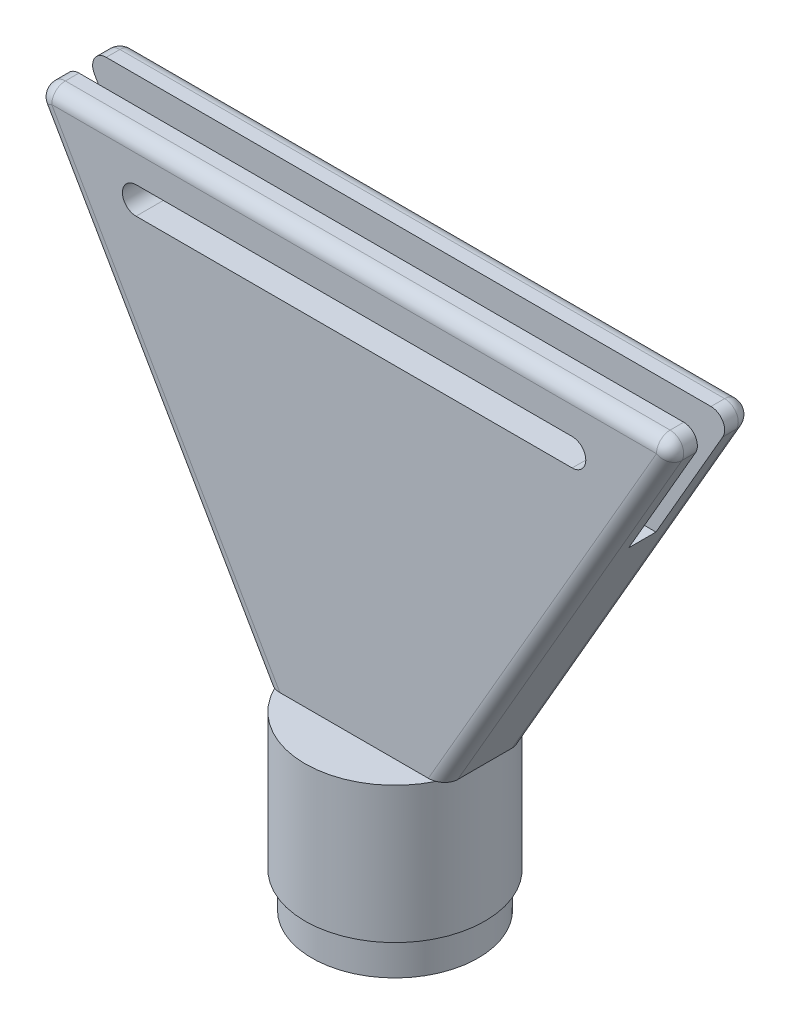
from build123d import *

# Parameters (mm, degrees)
SKETCH1_R           = 15.494
BOSS_EXTRUDE1_DEPTH = 6.604
SKETCH2_R           = 16.764
BOSS_EXTRUDE2_DEPTH = 25.4
BOSS_EXTRUDE3_DEPTH = 7.62
FILLET1_R           = 2.54
SKETCH5_W           = 117.797362922
SKETCH5_H           = 5.08
CUT_EXTRUDE1_DEPTH  = 25.4
CUT_EXTRUDE2_DEPTH  = 25.4


with BuildPart() as part:
    # Sketch1 → Boss-Extrude1 (new body)
    with BuildSketch(Plane(origin=(0, 0, 0), x_dir=(1, 0, 0), z_dir=(0, 1, 0))):
        with Locations(Location((0, 0, 0), (0, 0, 90))):
            Circle(SKETCH1_R)
    extrude(amount=BOSS_EXTRUDE1_DEPTH)

    # Sketch2 → Boss-Extrude2 (add)
    with BuildSketch(Plane(origin=(0, 6.604, 0), x_dir=(1, 0, 0), z_dir=(0, 1, 0))):
        with Locations(Location((0, 0, 0), (0, 0, 270))):
            Circle(SKETCH2_R)
    extrude(amount=BOSS_EXTRUDE2_DEPTH)

    # Sketch4 → Boss-Extrude3 (add, symmetric)
    with BuildSketch(Plane.XY):
        Polygon((16.764, 32.004), (60.758090512, 108.204), (-60.758090512, 108.204), (-16.764, 32.004), align=None)
    extrude(amount=BOSS_EXTRUDE3_DEPTH, both=True)

    # Fillet1
    # the kernel refuses this fillet: 2.54 mm, written as the material it takes off along each edge
    with BuildSketch(Plane(origin=(56.358681461, 105.664, -5.08), x_dir=(0.8660254037844399, -0.49999999999999795, 0), z_dir=(0, 0, -1))) as fillet1_piece_1_section:
        Polygon((0, 0), (FILLET1_R, 0), (FILLET1_R, -FILLET1_R * 1.73205080757), (-FILLET1_R * 0.5, -FILLET1_R * 0.866025403784), align=None)
    fillet1_piece_1 = extrude(amount=FILLET1_R, mode=Mode.PRIVATE)
    fillet1_piece_1 = fillet1_piece_1 - Plane(origin=(56.358681461, 105.664, -5.08), x_dir=(-0.8660254037844382, -0.500000000000001, 0), z_dir=(0, 0, -1)) * Sphere(FILLET1_R, mode=Mode.PRIVATE)
    add(fillet1_piece_1, mode=Mode.SUBTRACT)
    with BuildSketch(Plane(origin=(-56.358681461, 105.664, -5.08), x_dir=(0, 1, 0), z_dir=(0, 0, -1))) as fillet1_piece_2_section:
        Polygon((0, 0), (FILLET1_R, 0), (FILLET1_R, -FILLET1_R * 1.73205080757), (-FILLET1_R * 0.5, -FILLET1_R * 0.866025403784), align=None)
    fillet1_piece_2 = extrude(amount=FILLET1_R, mode=Mode.PRIVATE)
    fillet1_piece_2 = fillet1_piece_2 - Plane(origin=(-56.358681461, 105.664, -5.08), x_dir=(0.8660254037844382, -0.500000000000001, 0), z_dir=(0, 0, -1)) * Sphere(FILLET1_R, mode=Mode.PRIVATE)
    add(fillet1_piece_2, mode=Mode.SUBTRACT)
    with BuildSketch(Plane(origin=(56.358681461, 105.664, 5.08), x_dir=(0.8660254037844399, -0.49999999999999795, 0), z_dir=(0, 0, 1))) as fillet1_piece_3_section:
        Polygon((0, 0), (FILLET1_R, 0), (FILLET1_R, FILLET1_R * 1.73205080757), (-FILLET1_R * 0.5, FILLET1_R * 0.866025403784), align=None)
    fillet1_piece_3 = extrude(amount=FILLET1_R, mode=Mode.PRIVATE)
    fillet1_piece_3 = fillet1_piece_3 - Plane(origin=(56.358681461, 105.664, 5.08), x_dir=(-0.8660254037844382, -0.500000000000001, 0), z_dir=(0, 0, 1)) * Sphere(FILLET1_R, mode=Mode.PRIVATE)
    add(fillet1_piece_3, mode=Mode.SUBTRACT)
    with BuildSketch(Plane(origin=(-56.358681461, 105.664, 5.08), x_dir=(-0.8660254037844399, -0.49999999999999795, 0), z_dir=(0, 0, 1))) as fillet1_piece_4_section:
        Polygon((0, 0), (FILLET1_R, 0), (FILLET1_R, -FILLET1_R * 1.73205080757), (-FILLET1_R * 0.5, -FILLET1_R * 0.866025403784), align=None)
    fillet1_piece_4 = extrude(amount=FILLET1_R, mode=Mode.PRIVATE)
    fillet1_piece_4 = fillet1_piece_4 - Plane(origin=(-56.358681461, 105.664, 5.08), x_dir=(0.8660254037844382, -0.500000000000001, 0), z_dir=(0, 0, 1)) * Sphere(FILLET1_R, mode=Mode.PRIVATE)
    add(fillet1_piece_4, mode=Mode.SUBTRACT)
    with BuildSketch(Plane(origin=(13.589, 26.504738686, -7.62), x_dir=(-0.8660254037844398, 0.499999999999998, 0), z_dir=(0.49999999999999795, 0.8660254037844399, 0))) as fillet1_piece_5_section:
        with BuildLine():
            CenterArc((FILLET1_R, FILLET1_R), FILLET1_R, 180, 90)
            Line((0, FILLET1_R), (0, 0))
            Line((0, 0), (FILLET1_R, 0))
        make_face()
    fillet1_piece_5 = extrude(amount=89.938771973, mode=Mode.PRIVATE)
    fillet1_piece_5 = split(fillet1_piece_5, bisect_by=Plane(origin=(37.078105995, 32.004, -7.046175079), z_dir=(0, 1, 0)), keep=Keep.TOP, mode=Mode.PRIVATE)
    add(fillet1_piece_5, mode=Mode.SUBTRACT)
    with BuildSketch(Plane(origin=(56.358681461, 108.204, -7.62), x_dir=(0, -1, 0), z_dir=(-1, 0, 0))) as fillet1_piece_6:
        with BuildLine():
            CenterArc((FILLET1_R, FILLET1_R), FILLET1_R, 180, 90)
            Line((0, FILLET1_R), (0, 0))
            Line((0, 0), (FILLET1_R, 0))
        make_face()
    extrude(amount=112.717362922, mode=Mode.SUBTRACT)
    with BuildSketch(Plane(origin=(60.758090512, 108.204, -5.08), x_dir=(-0.49999999999999645, -0.8660254037844407, 0), z_dir=(0, 0, 1))) as fillet1_piece_7:
        with BuildLine():
            CenterArc((FILLET1_R * 1.73205080757, -FILLET1_R), FILLET1_R, 90, 120)
            Line((FILLET1_R * 0.866025403784, -FILLET1_R * 1.5), (0, 0))
            Line((0, 0), (FILLET1_R * 1.73205080757, 0))
        make_face()
    extrude(amount=10.16, mode=Mode.SUBTRACT)
    with BuildSketch(Plane(origin=(-58.558385987, 104.394, -7.62), x_dir=(0, 0, 1), z_dir=(0.49999999999999795, -0.8660254037844399, 0))) as fillet1_piece_8_section:
        with BuildLine():
            CenterArc((FILLET1_R, -FILLET1_R), FILLET1_R, 90, 90)
            Line((0, -FILLET1_R), (0, 0))
            Line((0, 0), (FILLET1_R, 0))
        make_face()
    fillet1_piece_8 = extrude(amount=89.938771973, mode=Mode.PRIVATE)
    fillet1_piece_8 = split(fillet1_piece_8, bisect_by=Plane(origin=(-37.078105995, 32.004, -7.046175079), z_dir=(0, 1, 0)), keep=Keep.TOP, mode=Mode.PRIVATE)
    add(fillet1_piece_8, mode=Mode.SUBTRACT)
    with BuildSketch(Plane(origin=(-60.758090512, 108.204, -5.08), x_dir=(0.4999999999999989, -0.8660254037844393, 0), z_dir=(0, 0, 1))) as fillet1_piece_9:
        with BuildLine():
            CenterArc((FILLET1_R * 1.73205080757, FILLET1_R), FILLET1_R, 150, 120)
            Line((FILLET1_R * 0.866025403784, FILLET1_R * 1.5), (0, 0))
            Line((0, 0), (FILLET1_R * 1.73205080757, 0))
        make_face()
    extrude(amount=10.16, mode=Mode.SUBTRACT)
    with BuildSketch(Plane(origin=(13.589, 26.504738686, 7.62), x_dir=(-0.8660254037844398, 0.499999999999998, 0), z_dir=(0.49999999999999795, 0.8660254037844399, 0))) as fillet1_piece_10_section:
        with BuildLine():
            CenterArc((FILLET1_R, -FILLET1_R), FILLET1_R, 90, 90)
            Line((0, -FILLET1_R), (0, 0))
            Line((0, 0), (FILLET1_R, 0))
        make_face()
    fillet1_piece_10 = extrude(amount=89.938771973, mode=Mode.PRIVATE)
    fillet1_piece_10 = split(fillet1_piece_10, bisect_by=Plane(origin=(37.078105995, 32.004, 7.046175079), z_dir=(0, 1, 0)), keep=Keep.TOP, mode=Mode.PRIVATE)
    add(fillet1_piece_10, mode=Mode.SUBTRACT)
    with BuildSketch(Plane(origin=(56.358681461, 108.204, 7.62), x_dir=(0, -1, 0), z_dir=(-1, 0, 0))) as fillet1_piece_11:
        with BuildLine():
            CenterArc((FILLET1_R, -FILLET1_R), FILLET1_R, 90, 90)
            Line((0, -FILLET1_R), (0, 0))
            Line((0, 0), (FILLET1_R, 0))
        make_face()
    extrude(amount=112.717362922, mode=Mode.SUBTRACT)
    with BuildSketch(Plane(origin=(-58.558385987, 104.394, 7.62), x_dir=(0.8660254037844399, 0.499999999999998, 0), z_dir=(0.49999999999999795, -0.8660254037844399, 0))) as fillet1_piece_12_section:
        with BuildLine():
            CenterArc((FILLET1_R, -FILLET1_R), FILLET1_R, 90, 90)
            Line((0, -FILLET1_R), (0, 0))
            Line((0, 0), (FILLET1_R, 0))
        make_face()
    fillet1_piece_12 = extrude(amount=89.938771973, mode=Mode.PRIVATE)
    fillet1_piece_12 = split(fillet1_piece_12, bisect_by=Plane(origin=(-37.078105995, 32.004, 7.046175079), z_dir=(0, 1, 0)), keep=Keep.TOP, mode=Mode.PRIVATE)
    add(fillet1_piece_12, mode=Mode.SUBTRACT)

    # Sketch5 → Cut-Extrude1 (cut)
    with BuildSketch(Plane(origin=(0, 108.204, 0), x_dir=(1, 0, 0), z_dir=(0, 1, 0))):
        Rectangle(SKETCH5_W, SKETCH5_H)
    extrude(amount=-CUT_EXTRUDE1_DEPTH, mode=Mode.SUBTRACT)

    # Sketch6 → Cut-Extrude2 (cut)
    with BuildSketch(Plane(origin=(0, 0, -7.62), x_dir=(-1, 0, 0), z_dir=(0, 0, -1))):
        with BuildLine():
            Line((-40.64, 100.584), (40.64, 100.584))
            ThreePointArc((40.64, 100.584), (43.18, 98.044), (40.64, 95.504))
            Line((40.64, 95.504), (-40.64, 95.504))
            ThreePointArc((-40.64, 95.504), (-43.18, 98.044), (-40.64, 100.584))
        make_face()
    extrude(amount=-CUT_EXTRUDE2_DEPTH, mode=Mode.SUBTRACT)


solid = part.part
